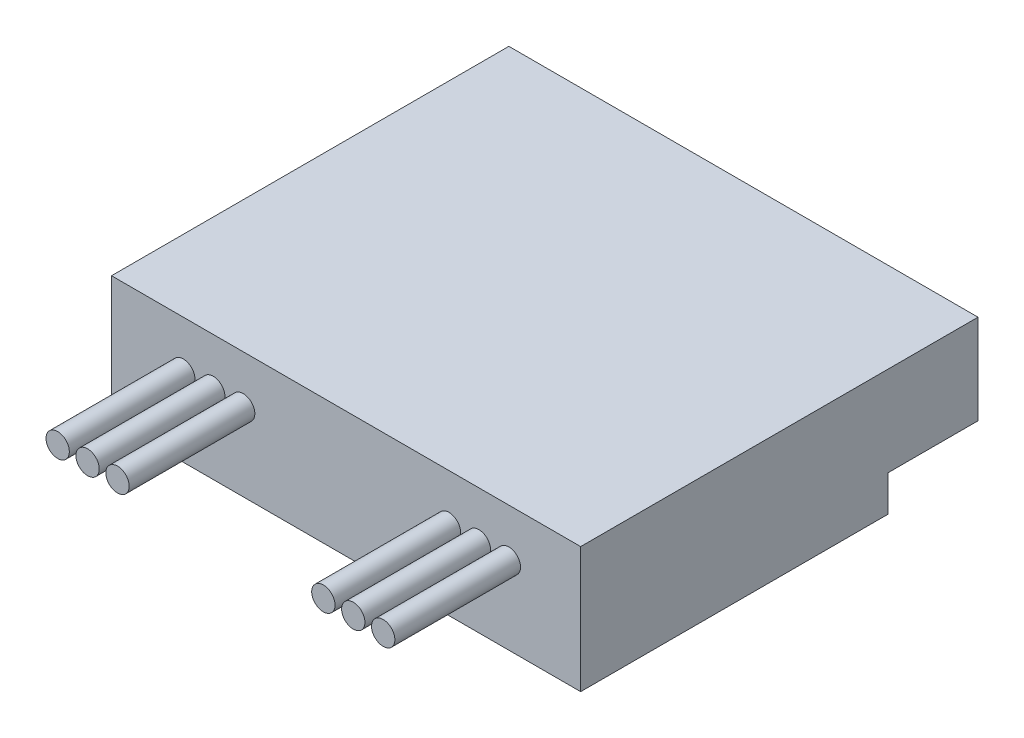
from build123d import *

# Parameters (mm, degrees)
SKETCH1_W           = 78.4
SKETCH1_H           = 66.4
BOSS_EXTRUDE1_DEPTH = 21
SKETCH2_R           = 1.95
BOSS_EXTRUDE2_DEPTH = 21
SKETCH3_W           = 32
SKETCH3_H           = 20
CUT_EXTRUDE1_DEPTH  = 10
SKETCH4_W           = 78.4
SKETCH4_H           = 15
CUT_EXTRUDE2_DEPTH  = 6
SKETCH5_R           = 1.95
BOSS_EXTRUDE6_DEPTH = 9


with BuildPart() as part:
    # Sketch1 → Boss-Extrude1 (new body)
    with BuildSketch(Plane(origin=(0, 0, 0), x_dir=(1, 0, 0), z_dir=(0, 1, 0))):
        with Locations((39.2, 33.2)):
            Rectangle(SKETCH1_W, SKETCH1_H)
    extrude(amount=BOSS_EXTRUDE1_DEPTH)

    # Sketch2 → Boss-Extrude2 (add)
    with BuildSketch(Plane.XY):
        with Locations((17, 13)):
            Circle(SKETCH2_R)
        with Locations((12, 13)):
            Circle(SKETCH2_R)
        with Locations((22, 13)):
            Circle(SKETCH2_R)
        with Locations((56.4, 13)):
            Circle(SKETCH2_R)
        with Locations((61.4, 13)):
            Circle(SKETCH2_R)
        with Locations((66.4, 13)):
            Circle(SKETCH2_R)
    extrude(amount=BOSS_EXTRUDE2_DEPTH)

    # Sketch3 → Cut-Extrude1 (cut)
    with BuildSketch(Plane.XZ):
        with Locations((36, -41.4)):
            Rectangle(SKETCH3_W, SKETCH3_H)
    extrude(amount=-CUT_EXTRUDE1_DEPTH, mode=Mode.SUBTRACT)

    # Sketch4 → Cut-Extrude2 (cut)
    with BuildSketch(Plane.XZ):
        with Locations((39.2, -58.9)):
            Rectangle(SKETCH4_W, SKETCH4_H)
    extrude(amount=-CUT_EXTRUDE2_DEPTH, mode=Mode.SUBTRACT)

    # Sketch5 → Boss-Extrude6 (add)
    with BuildSketch(Plane.XZ.offset(-10)):
        with Locations((49.05, -34.35)):
            Circle(SKETCH5_R)
        with Locations((34.15, -34.35)):
            Circle(SKETCH5_R)
    extrude(amount=BOSS_EXTRUDE6_DEPTH)


solid = part.part
